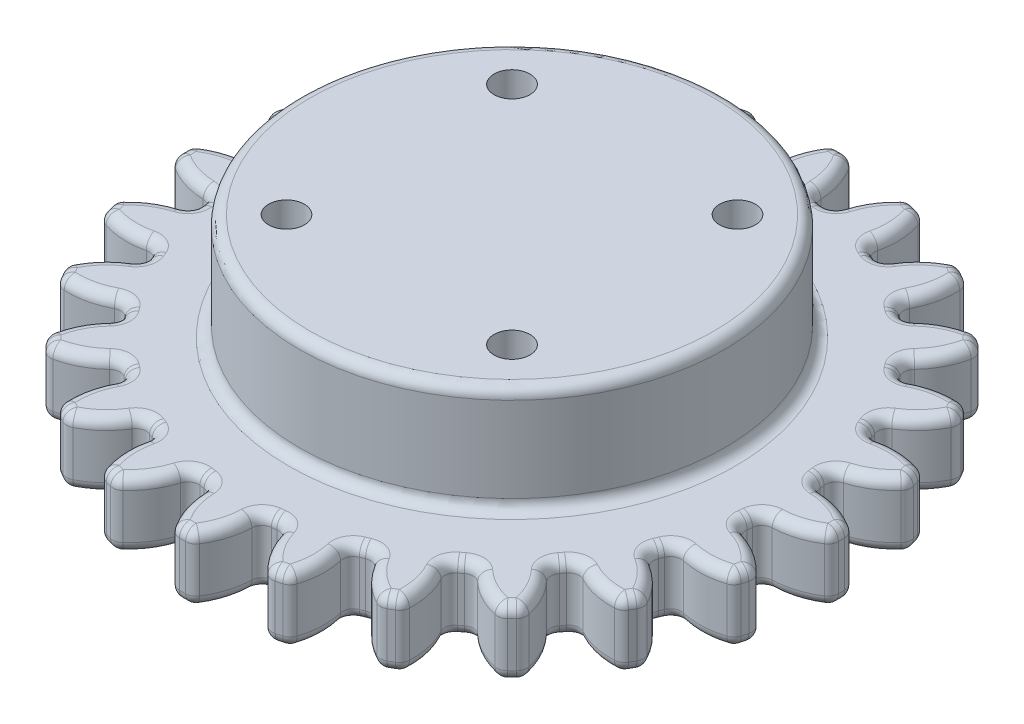
from build123d import *

# Parameters (mm, degrees)
BOSS_EXTRUDE1_DEPTH = 5
SKETCH4_R           = 16
BOSS_EXTRUDE2_DEPTH = 8
SKETCH5_R           = 13.1
CUT_EXTRUDE1_DEPTH  = 5
FILLET2_R           = 0.8
SKETCH6_R           = 1.35
CUT_EXTRUDE2_DEPTH  = 7


with BuildPart() as part:
    # Sketch2 → Boss-Extrude1 (new body)
    with BuildSketch(Plane(origin=(0, 0, 0), x_dir=(1, 0, 0), z_dir=(0, 1, 0))):
        with BuildLine():
            ThreePointArc((3.611499267, 20.481830133), (2.714657037, 20.619867355), (1.812647304, 20.718653487))
            ThreePointArc((1.812647304, 20.718653487), (1.606649612, 22.861926713), (0.646923861, 24.78935548))
            ThreePointArc((0.646923861, 24.78935548), (0, 24.797795378), (-0.646923861, 24.78935548))
            ThreePointArc((-0.646923861, 24.78935548), (-1.606649612, 22.861926713), (-1.812647304, 20.718653487))
            ThreePointArc((-1.812647304, 20.718653487), (-2.714657037, 20.619867355), (-3.611499267, 20.481830133))
            ThreePointArc((-3.611499267, 20.481830133), (-4.365197687, 22.498756969), (-5.791076849, 24.112114891))
            ThreePointArc((-5.791076849, 24.112114891), (-6.41814172, 23.95283099), (-7.040837779, 23.777242459))
            ThreePointArc((-7.040837779, 23.777242459), (-7.469006395, 21.667093932), (-7.113264956, 19.543534845))
            ThreePointArc((-7.113264956, 19.543534845), (-7.958971721, 19.214657471), (-8.78952813, 18.849203904))
            ThreePointArc((-8.78952813, 18.849203904), (-10.039563977, 20.602334119), (-11.834425242, 21.791673519))
            ThreePointArc((-11.834425242, 21.791673519), (-12.398897689, 21.475520755), (-12.954930238, 21.144749659))
            ThreePointArc((-12.954930238, 21.144749659), (-12.822362735, 18.995684507), (-11.929125357, 17.0365566))
            ThreePointArc((-11.929125357, 17.0365566), (-12.660895634, 16.500000433), (-13.368565177, 15.932035578))
            ThreePointArc((-13.368565177, 15.932035578), (-15.029750574, 17.301896245), (-17.071277112, 17.98616561))
            ThreePointArc((-17.071277112, 17.98616561), (-17.53468927, 17.53468927), (-17.98616561, 17.071277112))
            ThreePointArc((-17.98616561, 17.071277112), (-17.301896245, 15.029750574), (-15.932035578, 13.368565177))
            ThreePointArc((-15.932035578, 13.368565177), (-16.500000433, 12.660895634), (-17.0365566, 11.929125357))
            ThreePointArc((-17.0365566, 11.929125357), (-18.995684507, 12.822362735), (-21.144749659, 12.954930238))
            ThreePointArc((-21.144749659, 12.954930238), (-21.475520755, 12.398897689), (-21.791673519, 11.834425242))
            ThreePointArc((-21.791673519, 11.834425242), (-20.602334119, 10.039563977), (-18.849203904, 8.78952813))
            ThreePointArc((-18.849203904, 8.78952813), (-19.214657471, 7.958971721), (-19.543534845, 7.113264956))
            ThreePointArc((-19.543534845, 7.113264956), (-21.667093932, 7.469006395), (-23.777242459, 7.040837779))
            ThreePointArc((-23.777242459, 7.040837779), (-23.95283099, 6.41814172), (-24.112114891, 5.791076849))
            ThreePointArc((-24.112114891, 5.791076849), (-22.498756969, 4.365197687), (-20.481830133, 3.611499267))
            ThreePointArc((-20.481830133, 3.611499267), (-20.619867355, 2.714657037), (-20.718653487, 1.812647304))
            ThreePointArc((-20.718653487, 1.812647304), (-22.861926713, 1.606649612), (-24.78935548, 0.646923861))
            ThreePointArc((-24.78935548, 0.646923861), (-24.797795378, 0), (-24.78935548, -0.646923861))
            ThreePointArc((-24.78935548, -0.646923861), (-22.861926713, -1.606649612), (-20.718653487, -1.812647304))
            ThreePointArc((-20.718653487, -1.812647304), (-20.619867355, -2.714657037), (-20.481830133, -3.611499267))
            ThreePointArc((-20.481830133, -3.611499267), (-22.498756969, -4.365197687), (-24.112114891, -5.791076849))
            ThreePointArc((-24.112114891, -5.791076849), (-23.95283099, -6.41814172), (-23.777242459, -7.040837779))
            ThreePointArc((-23.777242459, -7.040837779), (-21.667093932, -7.469006395), (-19.543534845, -7.113264956))
            ThreePointArc((-19.543534845, -7.113264956), (-19.214657471, -7.958971721), (-18.849203904, -8.78952813))
            ThreePointArc((-18.849203904, -8.78952813), (-20.602334119, -10.039563977), (-21.791673519, -11.834425242))
            ThreePointArc((-21.791673519, -11.834425242), (-21.475520755, -12.398897689), (-21.144749659, -12.954930238))
            ThreePointArc((-21.144749659, -12.954930238), (-18.995684507, -12.822362735), (-17.0365566, -11.929125357))
            ThreePointArc((-17.0365566, -11.929125357), (-16.500000433, -12.660895634), (-15.932035578, -13.368565177))
            ThreePointArc((-15.932035578, -13.368565177), (-17.301896245, -15.029750574), (-17.98616561, -17.071277112))
            ThreePointArc((-17.98616561, -17.071277112), (-17.53468927, -17.53468927), (-17.071277112, -17.98616561))
            ThreePointArc((-17.071277112, -17.98616561), (-15.029750574, -17.301896245), (-13.368565177, -15.932035578))
            ThreePointArc((-13.368565177, -15.932035578), (-12.660895634, -16.500000433), (-11.929125357, -17.0365566))
            ThreePointArc((-11.929125357, -17.0365566), (-12.822362735, -18.995684507), (-12.954930238, -21.144749659))
            ThreePointArc((-12.954930238, -21.144749659), (-12.398897689, -21.475520755), (-11.834425242, -21.791673519))
            ThreePointArc((-11.834425242, -21.791673519), (-10.039563977, -20.602334119), (-8.78952813, -18.849203904))
            ThreePointArc((-8.78952813, -18.849203904), (-7.958971721, -19.214657471), (-7.113264956, -19.543534845))
            ThreePointArc((-7.113264956, -19.543534845), (-7.469006395, -21.667093932), (-7.040837779, -23.777242459))
            ThreePointArc((-7.040837779, -23.777242459), (-6.41814172, -23.95283099), (-5.791076849, -24.112114891))
            ThreePointArc((-5.791076849, -24.112114891), (-4.365197687, -22.498756969), (-3.611499267, -20.481830133))
            ThreePointArc((-3.611499267, -20.481830133), (-2.714657037, -20.619867355), (-1.812647304, -20.718653487))
            ThreePointArc((-1.812647304, -20.718653487), (-1.606649612, -22.861926713), (-0.646923861, -24.78935548))
            ThreePointArc((-0.646923861, -24.78935548), (0, -24.797795378), (0.646923861, -24.78935548))
            ThreePointArc((0.646923861, -24.78935548), (1.606649612, -22.861926713), (1.812647304, -20.718653487))
            ThreePointArc((1.812647304, -20.718653487), (2.714657037, -20.619867355), (3.611499267, -20.481830133))
            ThreePointArc((3.611499267, -20.481830133), (4.365197687, -22.498756969), (5.791076849, -24.112114891))
            ThreePointArc((5.791076849, -24.112114891), (6.41814172, -23.95283099), (7.040837779, -23.777242459))
            ThreePointArc((7.040837779, -23.777242459), (7.469006395, -21.667093932), (7.113264956, -19.543534845))
            ThreePointArc((7.113264956, -19.543534845), (7.958971721, -19.214657471), (8.78952813, -18.849203904))
            ThreePointArc((8.78952813, -18.849203904), (10.039563977, -20.602334119), (11.834425242, -21.791673519))
            ThreePointArc((11.834425242, -21.791673519), (12.398897689, -21.475520755), (12.954930238, -21.144749659))
            ThreePointArc((12.954930238, -21.144749659), (12.822362735, -18.995684507), (11.929125357, -17.0365566))
            ThreePointArc((11.929125357, -17.0365566), (12.660895634, -16.500000433), (13.368565177, -15.932035578))
            ThreePointArc((13.368565177, -15.932035578), (15.029750574, -17.301896245), (17.071277112, -17.98616561))
            ThreePointArc((17.071277112, -17.98616561), (17.53468927, -17.53468927), (17.98616561, -17.071277112))
            ThreePointArc((17.98616561, -17.071277112), (17.301896245, -15.029750574), (15.932035578, -13.368565177))
            ThreePointArc((15.932035578, -13.368565177), (16.500000433, -12.660895634), (17.0365566, -11.929125357))
            ThreePointArc((17.0365566, -11.929125357), (18.995684507, -12.822362735), (21.144749659, -12.954930238))
            ThreePointArc((21.144749659, -12.954930238), (21.475520755, -12.398897689), (21.791673519, -11.834425242))
            ThreePointArc((21.791673519, -11.834425242), (20.602334119, -10.039563977), (18.849203904, -8.78952813))
            ThreePointArc((18.849203904, -8.78952813), (19.214657471, -7.958971721), (19.543534845, -7.113264956))
            ThreePointArc((19.543534845, -7.113264956), (21.667093932, -7.469006395), (23.777242459, -7.040837779))
            ThreePointArc((23.777242459, -7.040837779), (23.95283099, -6.41814172), (24.112114891, -5.791076849))
            ThreePointArc((24.112114891, -5.791076849), (22.498756969, -4.365197687), (20.481830133, -3.611499267))
            ThreePointArc((20.481830133, -3.611499267), (20.619867355, -2.714657037), (20.718653487, -1.812647304))
            ThreePointArc((20.718653487, -1.812647304), (22.861926713, -1.606649612), (24.78935548, -0.646923861))
            ThreePointArc((24.78935548, -0.646923861), (24.797795378, 0), (24.78935548, 0.646923861))
            ThreePointArc((24.78935548, 0.646923861), (22.861926713, 1.606649612), (20.718653487, 1.812647304))
            ThreePointArc((20.718653487, 1.812647304), (20.619867355, 2.714657037), (20.481830133, 3.611499267))
            ThreePointArc((20.481830133, 3.611499267), (22.498756969, 4.365197687), (24.112114891, 5.791076849))
            ThreePointArc((24.112114891, 5.791076849), (23.95283099, 6.41814172), (23.777242459, 7.040837779))
            ThreePointArc((23.777242459, 7.040837779), (21.667093932, 7.469006395), (19.543534845, 7.113264956))
            ThreePointArc((19.543534845, 7.113264956), (19.214657471, 7.958971721), (18.849203904, 8.78952813))
            ThreePointArc((18.849203904, 8.78952813), (20.602334119, 10.039563977), (21.791673519, 11.834425242))
            ThreePointArc((21.791673519, 11.834425242), (21.475520755, 12.398897689), (21.144749659, 12.954930238))
            ThreePointArc((21.144749659, 12.954930238), (18.995684507, 12.822362735), (17.0365566, 11.929125357))
            ThreePointArc((17.0365566, 11.929125357), (16.500000433, 12.660895634), (15.932035578, 13.368565177))
            ThreePointArc((15.932035578, 13.368565177), (17.301896245, 15.029750574), (17.98616561, 17.071277112))
            ThreePointArc((17.98616561, 17.071277112), (17.53468927, 17.53468927), (17.071277112, 17.98616561))
            ThreePointArc((17.071277112, 17.98616561), (15.029750574, 17.301896245), (13.368565177, 15.932035578))
            ThreePointArc((13.368565177, 15.932035578), (12.660895634, 16.500000433), (11.929125357, 17.0365566))
            ThreePointArc((11.929125357, 17.0365566), (12.822362735, 18.995684507), (12.954930238, 21.144749659))
            ThreePointArc((12.954930238, 21.144749659), (12.398897689, 21.475520755), (11.834425242, 21.791673519))
            ThreePointArc((11.834425242, 21.791673519), (10.039563977, 20.602334119), (8.78952813, 18.849203904))
            ThreePointArc((8.78952813, 18.849203904), (7.958971721, 19.214657471), (7.113264956, 19.543534845))
            ThreePointArc((7.113264956, 19.543534845), (7.469006395, 21.667093932), (7.040837779, 23.777242459))
            ThreePointArc((7.040837779, 23.777242459), (6.41814172, 23.95283099), (5.791076849, 24.112114891))
            ThreePointArc((5.791076849, 24.112114891), (4.365197687, 22.498756969), (3.611499267, 20.481830133))
        make_face()
    extrude(amount=BOSS_EXTRUDE1_DEPTH)

    # Sketch4 → Boss-Extrude2 (add)
    with BuildSketch(Plane(origin=(0, 5, 0), x_dir=(1, 0, 0), z_dir=(0, 1, 0))):
        Circle(SKETCH4_R)
    extrude(amount=BOSS_EXTRUDE2_DEPTH)

    # Sketch5 → Cut-Extrude1 (cut)
    with BuildSketch(Plane.XZ):
        Circle(SKETCH5_R)
    extrude(amount=-CUT_EXTRUDE1_DEPTH, mode=Mode.SUBTRACT)

    # Fillet2
    fillet2_edges = [part.edges().sort_by_distance(p)[0] for p in [
        (-3.611499267, 2.5, -20.481830133),
        (-5.791076849, 2.5, -24.112114891),
        (-7.040837779, 2.5, -23.777242459),
        (-7.113264956, 2.5, -19.543534845),
        (-8.78952813, 2.5, -18.849203904),
        (-11.834425242, 2.5, -21.791673519),
        (-12.954930238, 2.5, -21.144749659),
        (-11.929125357, 2.5, -17.0365566),
        (-13.368565177, 2.5, -15.932035578),
        (-17.071277112, 2.5, -17.98616561),
        (-17.98616561, 2.5, -17.071277112),
        (-15.932035578, 2.5, -13.368565177),
        (-17.0365566, 2.5, -11.929125357),
        (-21.144749659, 2.5, -12.954930238),
        (-21.791673519, 2.5, -11.834425242),
        (-18.849203904, 2.5, -8.78952813),
        (-19.543534845, 2.5, -7.113264956),
        (-23.777242459, 2.5, -7.040837779),
        (-24.112114891, 2.5, -5.791076849),
        (-20.481830133, 2.5, -3.611499267),
        (-20.718653487, 2.5, -1.812647304),
        (-24.78935548, 2.5, -0.646923861),
        (-24.78935548, 2.5, 0.646923861),
        (-20.718653487, 2.5, 1.812647304),
        (-20.481830133, 2.5, 3.611499267),
        (-24.112114891, 2.5, 5.791076849),
        (-23.777242459, 2.5, 7.040837779),
        (-19.543534845, 2.5, 7.113264956),
        (-18.849203904, 2.5, 8.78952813),
        (-21.791673519, 2.5, 11.834425242),
        (-21.144749659, 2.5, 12.954930238),
        (-17.0365566, 2.5, 11.929125357),
        (-15.932035578, 2.5, 13.368565177),
        (-17.98616561, 2.5, 17.071277112),
        (-17.071277112, 2.5, 17.98616561),
        (-13.368565177, 2.5, 15.932035578),
        (-11.929125357, 2.5, 17.0365566),
        (-12.954930238, 2.5, 21.144749659),
        (-11.834425242, 2.5, 21.791673519),
        (-8.78952813, 2.5, 18.849203904),
        (-7.113264956, 2.5, 19.543534845),
        (-7.040837779, 2.5, 23.777242459),
        (-5.791076849, 2.5, 24.112114891),
        (-3.611499267, 2.5, 20.481830133),
        (-1.812647304, 2.5, 20.718653487),
        (-0.646923861, 2.5, 24.78935548),
        (0.646923861, 2.5, 24.78935548),
        (1.812647304, 2.5, 20.718653487),
        (3.611499267, 2.5, 20.481830133),
        (5.791076849, 2.5, 24.112114891),
        (7.040837779, 2.5, 23.777242459),
        (7.113264956, 2.5, 19.543534845),
        (8.78952813, 2.5, 18.849203904),
        (11.834425242, 2.5, 21.791673519),
        (12.954930238, 2.5, 21.144749659),
        (11.929125357, 2.5, 17.0365566),
        (13.368565177, 2.5, 15.932035578),
        (17.071277112, 2.5, 17.98616561),
        (17.98616561, 2.5, 17.071277112),
        (15.932035578, 2.5, 13.368565177),
        (17.0365566, 2.5, 11.929125357),
        (21.144749659, 2.5, 12.954930238),
        (21.791673519, 2.5, 11.834425242),
        (18.849203904, 2.5, 8.78952813),
        (19.543534845, 2.5, 7.113264956),
        (23.777242459, 2.5, 7.040837779),
        (24.112114891, 2.5, 5.791076849),
        (20.481830133, 2.5, 3.611499267),
        (20.718653487, 2.5, 1.812647304),
        (24.78935548, 2.5, 0.646923861),
        (24.78935548, 2.5, -0.646923861),
        (20.718653487, 2.5, -1.812647304),
        (20.481830133, 2.5, -3.611499267),
        (24.112114891, 2.5, -5.791076849),
        (23.777242459, 2.5, -7.040837779),
        (19.543534845, 2.5, -7.113264956),
        (18.849203904, 2.5, -8.78952813),
        (21.791673519, 2.5, -11.834425242),
        (21.144749659, 2.5, -12.954930238),
        (17.0365566, 2.5, -11.929125357),
        (15.932035578, 2.5, -13.368565177),
        (17.98616561, 2.5, -17.071277112),
        (17.071277112, 2.5, -17.98616561),
        (13.368565177, 2.5, -15.932035578),
        (11.929125357, 2.5, -17.0365566),
        (12.954930238, 2.5, -21.144749659),
        (11.834425242, 2.5, -21.791673519),
        (8.78952813, 2.5, -18.849203904),
        (7.113264956, 2.5, -19.543534845),
        (7.040837779, 2.5, -23.777242459),
        (5.791076849, 2.5, -24.112114891),
        (3.611499267, 2.5, -20.481830133),
        (1.812647304, 2.5, -20.718653487),
        (0.646923861, 2.5, -24.78935548),
        (-0.646923861, 2.5, -24.78935548),
        (-1.812647304, 2.5, -20.718653487),
        (-1.606649612, 5, -22.861926713),
        (0, 5, -24.797795378),
        (1.606649612, 5, -22.861926713),
        (2.714657037, 5, -20.619867355),
        (4.365197687, 5, -22.498756969),
        (6.41814172, 5, -23.95283099),
        (7.469006395, 5, -21.667093932),
        (7.958971721, 5, -19.214657471),
        (10.039563977, 5, -20.602334119),
        (12.398897689, 5, -21.475520755),
        (12.822362735, 5, -18.995684507),
        (12.660895634, 5, -16.500000433),
        (15.029750574, 5, -17.301896245),
        (17.53468927, 5, -17.53468927),
        (17.301896245, 5, -15.029750574),
        (16.500000433, 5, -12.660895634),
        (18.995684507, 5, -12.822362735),
        (21.475520755, 5, -12.398897689),
        (20.602334119, 5, -10.039563977),
        (19.214657471, 5, -7.958971721),
        (21.667093932, 5, -7.469006395),
        (23.95283099, 5, -6.41814172),
        (22.498756969, 5, -4.365197687),
        (20.619867355, 5, -2.714657037),
        (22.861926713, 5, -1.606649612),
        (24.797795378, 5, 0),
        (22.861926713, 5, 1.606649612),
        (20.619867355, 5, 2.714657037),
        (22.498756969, 5, 4.365197687),
        (23.95283099, 5, 6.41814172),
        (21.667093932, 5, 7.469006395),
        (19.214657471, 5, 7.958971721),
        (20.602334119, 5, 10.039563977),
        (21.475520755, 5, 12.398897689),
        (18.995684507, 5, 12.822362735),
        (16.500000433, 5, 12.660895634),
        (17.301896245, 5, 15.029750574),
        (17.53468927, 5, 17.53468927),
        (15.029750574, 5, 17.301896245),
        (12.660895634, 5, 16.500000433),
        (12.822362735, 5, 18.995684507),
        (12.398897689, 5, 21.475520755),
        (10.039563977, 5, 20.602334119),
        (7.958971721, 5, 19.214657471),
        (7.469006395, 5, 21.667093932),
        (6.41814172, 5, 23.95283099),
        (4.365197687, 5, 22.498756969),
        (2.714657037, 5, 20.619867355),
        (1.606649612, 5, 22.861926713),
        (0, 5, 24.797795378),
        (-1.606649612, 5, 22.861926713),
        (-2.714657037, 5, 20.619867355),
        (-4.365197687, 5, 22.498756969),
        (-6.41814172, 5, 23.95283099),
        (-7.469006395, 5, 21.667093932),
        (-7.958971721, 5, 19.214657471),
        (-10.039563977, 5, 20.602334119),
        (-12.398897689, 5, 21.475520755),
        (-12.822362735, 5, 18.995684507),
        (-12.660895634, 5, 16.500000433),
        (-15.029750574, 5, 17.301896245),
        (-17.53468927, 5, 17.53468927),
        (-17.301896245, 5, 15.029750574),
        (-16.500000433, 5, 12.660895634),
        (-18.995684507, 5, 12.822362735),
        (-21.475520755, 5, 12.398897689),
        (-20.602334119, 5, 10.039563977),
        (-19.214657471, 5, 7.958971721),
        (-21.667093932, 5, 7.469006395),
        (-23.95283099, 5, 6.41814172),
        (-22.498756969, 5, 4.365197687),
        (-20.619867355, 5, 2.714657037),
        (-22.861926713, 5, 1.606649612),
        (-24.797795378, 5, 0),
        (-22.861926713, 5, -1.606649612),
        (-20.619867355, 5, -2.714657037),
        (-22.498756969, 5, -4.365197687),
        (-23.95283099, 5, -6.41814172),
        (-21.667093932, 5, -7.469006395),
        (-19.214657471, 5, -7.958971721),
        (-20.602334119, 5, -10.039563977),
        (-21.475520755, 5, -12.398897689),
        (-18.995684507, 5, -12.822362735),
        (-16.500000433, 5, -12.660895634),
        (-17.301896245, 5, -15.029750574),
        (-17.53468927, 5, -17.53468927),
        (-15.029750574, 5, -17.301896245),
        (-12.660895634, 5, -16.500000433),
        (-12.822362735, 5, -18.995684507),
        (-12.398897689, 5, -21.475520755),
        (-10.039563977, 5, -20.602334119),
        (-7.958971721, 5, -19.214657471),
        (-7.469006395, 5, -21.667093932),
        (-6.41814172, 5, -23.95283099),
        (-4.365197687, 5, -22.498756969),
        (-2.714657037, 5, -20.619867355),
        (-1.606649612, 0, -22.861926713),
        (0, 0, -24.797795378),
        (1.606649612, 0, -22.861926713),
        (2.714657037, 0, -20.619867355),
        (4.365197687, 0, -22.498756969),
        (6.41814172, 0, -23.95283099),
        (7.469006395, 0, -21.667093932),
        (7.958971721, 0, -19.214657471),
        (10.039563977, 0, -20.602334119),
        (12.398897689, 0, -21.475520755),
        (12.822362735, 0, -18.995684507),
        (12.660895634, 0, -16.500000433),
        (15.029750574, 0, -17.301896245),
        (17.53468927, 0, -17.53468927),
        (17.301896245, 0, -15.029750574),
        (16.500000433, 0, -12.660895634),
        (18.995684507, 0, -12.822362735),
        (21.475520755, 0, -12.398897689),
        (20.602334119, 0, -10.039563977),
        (19.214657471, 0, -7.958971721),
        (21.667093932, 0, -7.469006395),
        (23.95283099, 0, -6.41814172),
        (22.498756969, 0, -4.365197687),
        (20.619867355, 0, -2.714657037),
        (22.861926713, 0, -1.606649612),
        (24.797795378, 0, 0),
        (22.861926713, 0, 1.606649612),
        (20.619867355, 0, 2.714657037),
        (22.498756969, 0, 4.365197687),
        (23.95283099, 0, 6.41814172),
        (21.667093932, 0, 7.469006395),
        (19.214657471, 0, 7.958971721),
        (20.602334119, 0, 10.039563977),
        (21.475520755, 0, 12.398897689),
        (18.995684507, 0, 12.822362735),
        (16.500000433, 0, 12.660895634),
        (17.301896245, 0, 15.029750574),
        (17.53468927, 0, 17.53468927),
        (15.029750574, 0, 17.301896245),
        (12.660895634, 0, 16.500000433),
        (12.822362735, 0, 18.995684507),
        (12.398897689, 0, 21.475520755),
        (10.039563977, 0, 20.602334119),
        (7.958971721, 0, 19.214657471),
        (7.469006395, 0, 21.667093932),
        (6.41814172, 0, 23.95283099),
        (4.365197687, 0, 22.498756969),
        (2.714657037, 0, 20.619867355),
        (1.606649612, 0, 22.861926713),
        (0, 0, 24.797795378),
        (-1.606649612, 0, 22.861926713),
        (-2.714657037, 0, 20.619867355),
        (-4.365197687, 0, 22.498756969),
        (-6.41814172, 0, 23.95283099),
        (-7.469006395, 0, 21.667093932),
        (-7.958971721, 0, 19.214657471),
        (-10.039563977, 0, 20.602334119),
        (-12.398897689, 0, 21.475520755),
        (-12.822362735, 0, 18.995684507),
        (-12.660895634, 0, 16.500000433),
        (-15.029750574, 0, 17.301896245),
        (-17.53468927, 0, 17.53468927),
        (-17.301896245, 0, 15.029750574),
        (-16.500000433, 0, 12.660895634),
        (-18.995684507, 0, 12.822362735),
        (-21.475520755, 0, 12.398897689),
        (-20.602334119, 0, 10.039563977),
        (-19.214657471, 0, 7.958971721),
        (-21.667093932, 0, 7.469006395),
        (-23.95283099, 0, 6.41814172),
        (-22.498756969, 0, 4.365197687),
        (-20.619867355, 0, 2.714657037),
        (-22.861926713, 0, 1.606649612),
        (-24.797795378, 0, 0),
        (-22.861926713, 0, -1.606649612),
        (-20.619867355, 0, -2.714657037),
        (-22.498756969, 0, -4.365197687),
        (-23.95283099, 0, -6.41814172),
        (-21.667093932, 0, -7.469006395),
        (-19.214657471, 0, -7.958971721),
        (-20.602334119, 0, -10.039563977),
        (-21.475520755, 0, -12.398897689),
        (-18.995684507, 0, -12.822362735),
        (-16.500000433, 0, -12.660895634),
        (-17.301896245, 0, -15.029750574),
        (-17.53468927, 0, -17.53468927),
        (-15.029750574, 0, -17.301896245),
        (-12.660895634, 0, -16.500000433),
        (-12.822362735, 0, -18.995684507),
        (-12.398897689, 0, -21.475520755),
        (-10.039563977, 0, -20.602334119),
        (-7.958971721, 0, -19.214657471),
        (-7.469006395, 0, -21.667093932),
        (-6.41814172, 0, -23.95283099),
        (-4.365197687, 0, -22.498756969),
        (-2.714657037, 0, -20.619867355),
        (-16, 5, 0),
        (-16, 13, 0),
        (-13.1, 0, 0),
    ]]
    fillet(fillet2_edges, radius=FILLET2_R)

    # Sketch6 → Cut-Extrude2 (cut)
    with BuildSketch(Plane(origin=(0, 13, 0), x_dir=(1, 0, 0), z_dir=(0, 1, 0))):
        with Locations((-8.485281374, 8.485281374)):
            Circle(SKETCH6_R)
        with Locations((8.485281374, 8.485281374)):
            Circle(SKETCH6_R)
        with Locations((8.485281374, -8.485281374)):
            Circle(SKETCH6_R)
        with Locations((-8.485281374, -8.485281374)):
            Circle(SKETCH6_R)
    extrude(amount=-CUT_EXTRUDE2_DEPTH, mode=Mode.SUBTRACT)


solid = part.part
